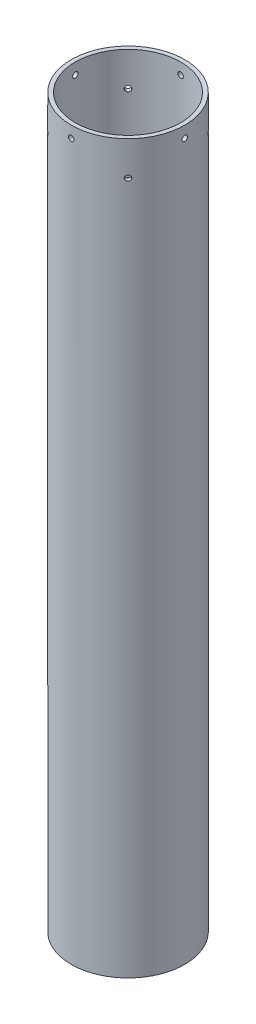
from build123d import *

# Parameters (mm, degrees)
SKETCH_1_R               = 25
SKETCH_1_R_2             = 23.2
EXTRUDE_1_DEPTH          = 320
SKETCH_2_R               = 1.2
CUT_EXTRUDE_1_DEPTH      = 322.94720064
PATTERN_CIRCULAR_1_COUNT = 4
SKETCH_3_R               = 1.2
CUT_EXTRUDE_2_DEPTH      = 322.947200756
PATTERN_CIRCULAR_2_COUNT = 4


with BuildPart() as part:
    # Эскиз1 → Бобышка-Вытянуть1 (new body)
    with BuildSketch(Plane(origin=(0, 0, 0), x_dir=(1, 0, 0), z_dir=(0, 1, 0))):
        Circle(SKETCH_1_R)
        Circle(SKETCH_1_R_2, mode=Mode.SUBTRACT)
    extrude(amount=EXTRUDE_1_DEPTH)

    # Эскиз2 → Вырез-Вытянуть1 (cut, through all)
    with BuildSketch(Plane(origin=(0, 0, 0), x_dir=(0, 0, -1), z_dir=(1, 0, 0))):
        with Locations((0, 315)):
            Circle(SKETCH_2_R)
    cut_extrude_1 = extrude(amount=-CUT_EXTRUDE_1_DEPTH, mode=Mode.SUBTRACT)

    # Круговой массив1: Вырез-Вытянуть1 ×4 about axis
    pattern_circular_1_axis = Axis((0, 320, 0), (0, -1, 0))
    for i in range(1, PATTERN_CIRCULAR_1_COUNT):
        add(cut_extrude_1.rotate(pattern_circular_1_axis, i * 360 / PATTERN_CIRCULAR_1_COUNT), mode=Mode.SUBTRACT)

    # Эскиз3 → Вырез-Вытянуть2 (cut, through all)
    with BuildSketch(Plane(origin=(0, 0, 0), x_dir=(0, -1, 0), z_dir=(-0.7071067811865488, 0, 0.7071067811865464))):
        with Locations((-305, 0)):
            Circle(SKETCH_3_R)
    cut_extrude_2 = extrude(amount=-CUT_EXTRUDE_2_DEPTH, mode=Mode.SUBTRACT)

    # Круговой массив2: Вырез-Вытянуть2 ×4 about axis
    pattern_circular_2_axis = Axis((0, 320, 0), (0, -1, 0))
    for i in range(1, PATTERN_CIRCULAR_2_COUNT):
        add(cut_extrude_2.rotate(pattern_circular_2_axis, i * 360 / PATTERN_CIRCULAR_2_COUNT), mode=Mode.SUBTRACT)


solid = part.part
